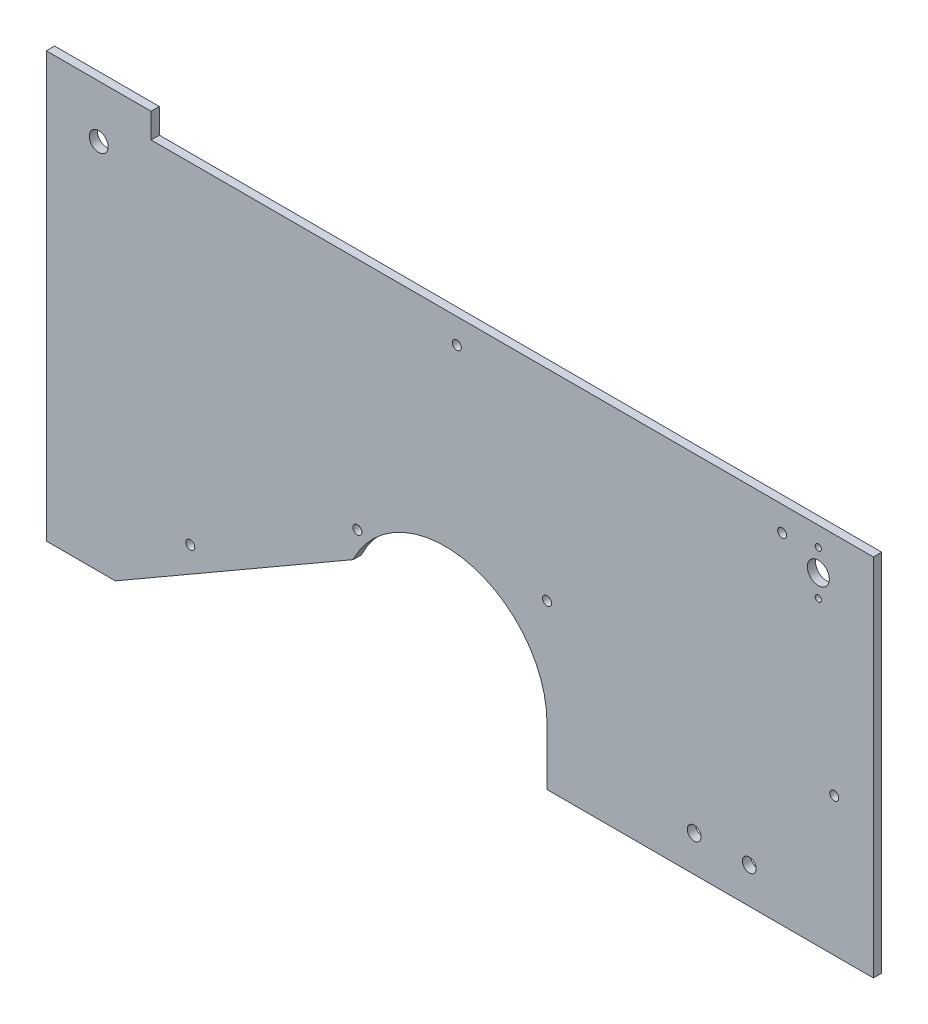
from build123d import *

# Parameters (mm, degrees)
SKETCH2_R           = 3.425
BOSS_EXTRUDE2_DEPTH = 3
SKETCH3_W           = 118.4
SKETCH3_H           = 12.75
CUT_EXTRUDE1_DEPTH  = 338.231374578
SKETCH5_R           = 2.5
SKETCH5_R_2         = 4
SKETCH5_R_3         = 1.125
SKETCH5_R_4         = 1.625
CUT_EXTRUDE2_DEPTH  = 338.231374578


with BuildPart() as part:
    # Sketch2 → Boss-Extrude2 (new body)
    with BuildSketch(Plane.XY):
        with BuildLine():
            Line((25.03035901, 0), (111.286489227, 49.8))
            ThreePointArc((111.286489227, 49.8), (152.858332199, 69.766604349), (181.6, 33.7))
            Line((181.6, 33.7), (181.6, 0))
            Line((181.6, 0), (300, 0))
            Line((300, 0), (300, 145))
            Line((300, 145), (38, 145))
            Line((38, 145), (38, 154))
            Line((38, 154), (19, 154))
            Line((19, 154), (0, 154))
            Line((0, 154), (0, 0))
            Line((0, 0), (25.03035901, 0))
        make_face()
        with Locations((19, 135)):
            Circle(SKETCH2_R, mode=Mode.SUBTRACT)
    extrude(amount=BOSS_EXTRUDE2_DEPTH)

    # Sketch3 → Cut-Extrude1 (cut, through all)
    with BuildSketch(Plane.XY.offset(3)):
        with Locations((240.8, 6.375)):
            Rectangle(SKETCH3_W, SKETCH3_H)
    extrude(amount=-CUT_EXTRUDE1_DEPTH, mode=Mode.SUBTRACT)

    # Sketch5 → Cut-Extrude2 (cut, through all)
    with BuildSketch(Plane.XY.offset(3)):
        with Locations((254.98, 25.75)):
            Circle(SKETCH5_R)
        with Locations((234.98, 25.75)):
            Circle(SKETCH5_R)
        with Locations((280, 130)):
            Circle(SKETCH5_R_2)
        with Locations((280, 138)):
            Circle(SKETCH5_R_3)
        with Locations((280, 122)):
            Circle(SKETCH5_R_3)
        with Locations((181.6, 72.03)):
            Circle(SKETCH5_R_4)
        with Locations((285.78, 62.92)):
            Circle(SKETCH5_R_4)
        with Locations((52.23, 24.91)):
            Circle(SKETCH5_R_4)
        with Locations((112.84, 59.93)):
            Circle(SKETCH5_R_4)
        with Locations((266.89, 135.99)):
            Circle(SKETCH5_R_4)
        with Locations((148.89, 135.99)):
            Circle(SKETCH5_R_4)
    extrude(amount=-CUT_EXTRUDE2_DEPTH, mode=Mode.SUBTRACT)


solid = part.part
